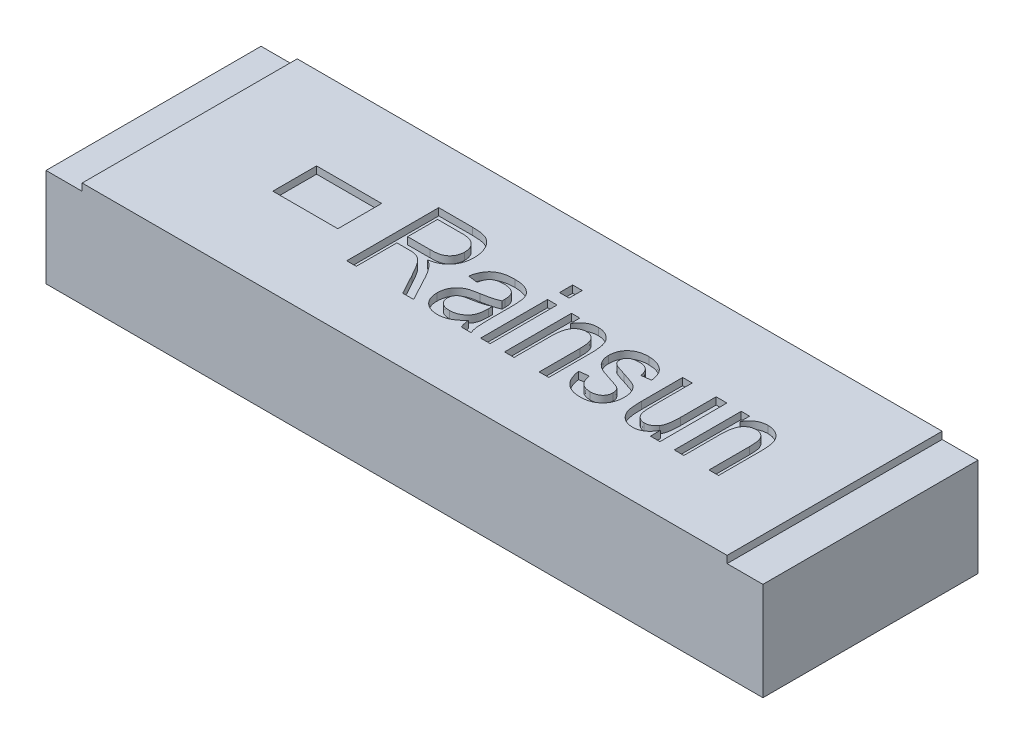
from build123d import *

# Parameters (mm, degrees)
ESQUISSE1_W             = 10
ESQUISSE1_H             = 3
BOSS_EXTRU_1_DEPTH      = 1.47
ESQUISSE2_W             = 0.907288546
ESQUISSE2_H             = 0.61051192
ENL_V_MAT_EXTRU_1_DEPTH = 0.1
ESQUISSE3_W             = 0.504272693
ESQUISSE3_H             = 3
ESQUISSE3_W_2           = 0.500030517
ENL_V_MAT_EXTRU_2_DEPTH = 0.1
ESQUISSE4_W             = 0.133419152
ESQUISSE4_H             = 0.183451335
ESQUISSE4_H_2           = 0.933934067
ENL_V_MAT_EXTRU_3_DEPTH = 0.1


with BuildPart() as part:
    # Esquisse1 → Boss.-Extru.1 (new body)
    with BuildSketch(Plane(origin=(0, 0, 0), x_dir=(1, 0, 0), z_dir=(0, 1, 0))):
        Rectangle(ESQUISSE1_W, ESQUISSE1_H)
    extrude(amount=BOSS_EXTRU_1_DEPTH)

    # Esquisse2 → Enlèv. mat.-Extru.1 (cut)
    with BuildSketch(Plane(origin=(0, 1.47, 0), x_dir=(1, 0, 0), z_dir=(0, 1, 0))):
        with Locations((-2.613912431, 0.036415608)):
            Rectangle(ESQUISSE2_W, ESQUISSE2_H)
    extrude(amount=-ENL_V_MAT_EXTRU_1_DEPTH, mode=Mode.SUBTRACT)

    # Esquisse3 → Enlèv. mat.-Extru.2 (cut)
    with BuildSketch(Plane(origin=(0, 1.47, 0), x_dir=(1, 0, 0), z_dir=(0, 1, 0))):
        with Locations((-4.747863653, 0)):
            Rectangle(ESQUISSE3_W, ESQUISSE3_H)
        with Locations((4.749984742, 0)):
            Rectangle(ESQUISSE3_W_2, ESQUISSE3_H)
    extrude(amount=-ENL_V_MAT_EXTRU_2_DEPTH, mode=Mode.SUBTRACT)

    # Esquisse4 → Enlèv. mat.-Extru.3 (cut)
    # profile 1 of 8: a face of its own
    with BuildSketch(Plane(origin=(0, 1.47, 0), x_dir=(1, 0, 0), z_dir=(0, 1, 0))):
        with BuildLine():
            Line((-1.711203724, -0.594725924), (-1.711203724, 0.689433418))
            Line((-1.711203724, 0.689433418), (-1.239546173, 0.689433418))
            add(Edge.make_bspline(
                [(-1.239546173, 0.689433418), (-1.227643365, 0.689364904), (-1.204604255, 0.689232288), (-1.171228767, 0.687324534), (-1.14019478, 0.684500455), (-1.11154364, 0.68074553), (-1.085442604, 0.675539719), (-1.061788164, 0.669224698), (-1.040387881, 0.662175813), (-1.015264758, 0.650548614), (-0.986602457, 0.632513675), (-0.955690187, 0.605036536), (-0.928613558, 0.571009644), (-0.904519375, 0.53191409), (-0.884732486, 0.488019038), (-0.870716548, 0.440148818), (-0.862255403, 0.388932385), (-0.861198821, 0.353660202), (-0.860656627, 0.335559963)],
                knots=[0, 0, 0, 0, 0.957775898, 1.853873864, 2.6892683, 3.465319774, 4.178195347, 4.829309051, 5.435011313, 5.988660553, 7.053440284, 8.147710094, 9.30058322, 10.540256924, 11.835580405, 13.162637032, 14.543981594, 16, 16, 16, 16], degree=3))
            add(Edge.make_bspline(
                [(-0.860656627, 0.335559963), (-0.860940115, 0.323565398), (-0.861493857, 0.300136264), (-0.864848274, 0.265796806), (-0.870677477, 0.233224026), (-0.879592243, 0.202502208), (-0.889931186, 0.173249583), (-0.903507548, 0.14597893), (-0.919083837, 0.120338051), (-0.937187905, 0.096530749), (-0.95743797, 0.07461011), (-0.980164448, 0.054920702), (-1.004925444, 0.037182941), (-1.031914027, 0.021552574), (-1.060963165, 0.007829531), (-1.092416471, -0.003120876), (-1.125783737, -0.012710434), (-1.148993522, -0.017108947), (-1.16084972, -0.01935583)],
                knots=[0, 0, 0, 0, 1.121977975, 2.191573688, 3.224240956, 4.211948119, 5.180998842, 6.122125515, 7.055751929, 7.983633331, 8.914994346, 9.842128418, 10.791356962, 11.759862547, 12.75578979, 13.791489111, 14.871831714, 16, 16, 16, 16], degree=3))
            add(Edge.make_bspline(
                [(-1.16084972, -0.01935583), (-1.15209864, -0.02419759), (-1.13543998, -0.033414423), (-1.112641995, -0.0482849), (-1.093158501, -0.063252769), (-1.082144301, -0.074145073), (-1.076941581, -0.079290214)],
                knots=[0, 0, 0, 0, 1.158843086, 2.205987482, 3.152571606, 4, 4, 4, 4], degree=3))
            add(Edge.make_bspline(
                [(-1.076941581, -0.079290214), (-1.066535426, -0.091850862), (-1.045606098, -0.117113401), (-1.01691532, -0.157416614), (-0.989433334, -0.199343229), (-0.973294618, -0.228836442), (-0.965150924, -0.243718896)],
                knots=[0, 0, 0, 0, 0.982253192, 1.975551771, 2.978451105, 4, 4, 4, 4], degree=3))
            Line((-0.965150924, -0.243718896), (-0.777269657, -0.594725924))
            Line((-0.777269657, -0.594725924), (-0.928929709, -0.594725924))
            Line((-0.928929709, -0.594725924), (-1.077202165, -0.320070091))
            add(Edge.make_bspline(
                [(-1.077202165, -0.320070091), (-1.084109369, -0.307191841), (-1.0973212, -0.282558822), (-1.116928928, -0.247583567), (-1.135155684, -0.216041069), (-1.151970687, -0.187900565), (-1.167623128, -0.163460596), (-1.1816813, -0.142385321), (-1.194555973, -0.124914746), (-1.209964918, -0.106914778), (-1.227875314, -0.088255969), (-1.249166419, -0.069516677), (-1.270432795, -0.054989597), (-1.292084881, -0.043926756), (-1.315919177, -0.036638884), (-1.342775739, -0.031183817), (-1.373855876, -0.028216674), (-1.395890981, -0.027875941), (-1.407623035, -0.027694527)],
                knots=[0, 0, 0, 0, 1.483643366, 2.83785556, 4.070616892, 5.1822306, 6.165666296, 7.016844219, 7.754091418, 8.367230408, 9.421242841, 10.377779407, 11.241203819, 12.029974219, 12.835959019, 13.762973995, 14.808950166, 16, 16, 16, 16], degree=3))
            Line((-1.407623035, -0.027694527), (-1.577784571, -0.027694527))
            Line((-1.577784571, -0.027694527), (-1.577784571, -0.594725924))
            Line((-1.577784571, -0.594725924), (-1.711203724, -0.594725924))
        make_face()
        with BuildLine():
            Line((-1.577784571, 0.12240202), (-1.264822848, 0.12240202))
            add(Edge.make_bspline(
                [(-1.264822848, 0.12240202), (-1.248745125, 0.122715215), (-1.218613901, 0.123302174), (-1.176460328, 0.127200432), (-1.140481046, 0.134254808), (-1.110003996, 0.144529186), (-1.084015817, 0.158143083), (-1.061389703, 0.175001763), (-1.041543621, 0.195135881), (-1.02466241, 0.21842467), (-1.010704546, 0.244359545), (-1.001284115, 0.272869431), (-0.994889904, 0.303137004), (-0.994351573, 0.324059408), (-0.994075779, 0.33477821)],
                knots=[0, 0, 0, 0, 1.47306528, 2.760668081, 3.873497699, 4.82484281, 5.696997418, 6.550136397, 7.399890849, 8.276969651, 9.17766846, 10.086208714, 11.019541422, 12, 12, 12, 12], degree=3))
            add(Edge.make_bspline(
                [(-0.994075779, 0.33477821), (-0.994316651, 0.342513932), (-0.994786236, 0.357594925), (-0.997256924, 0.379626815), (-1.002078976, 0.400359423), (-1.008441377, 0.41990416), (-1.016995256, 0.438082464), (-1.026984163, 0.455181281), (-1.039564038, 0.470497613), (-1.053253875, 0.484997606), (-1.069096819, 0.497870289), (-1.086789186, 0.50902418), (-1.106327409, 0.51839365), (-1.127523907, 0.526427584), (-1.15080889, 0.531771478), (-1.175636647, 0.53639986), (-1.202315812, 0.538965888), (-1.22069229, 0.539210683), (-1.230165139, 0.539336871)],
                knots=[0, 0, 0, 0, 1.045235731, 2.037714497, 2.988326782, 3.915852726, 4.808207886, 5.697550021, 6.58254782, 7.478674216, 8.387536059, 9.331464042, 10.296946822, 11.310355404, 12.385965615, 13.518246496, 14.720686494, 16, 16, 16, 16], degree=3))
            Line((-1.230165139, 0.539336871), (-1.577784571, 0.539336871))
            Line((-1.577784571, 0.539336871), (-1.577784571, 0.12240202))
        make_face(mode=Mode.SUBTRACT)
    # profile 2 of 8: a face of its own
    with BuildSketch(Plane(origin=(0, 1.47, 0), x_dir=(1, 0, 0), z_dir=(0, 1, 0))):
        with BuildLine():
            add(Edge.make_bspline(
                [(-0.143528682, -0.465997289), (-0.154468235, -0.477471687), (-0.175736193, -0.499779456), (-0.209803201, -0.52937873), (-0.244547246, -0.554585977), (-0.280014058, -0.575345502), (-0.316234056, -0.59134839), (-0.352977132, -0.603013507), (-0.39055834, -0.60999292), (-0.41589769, -0.610932184), (-0.428607887, -0.611403319)],
                knots=[0, 0, 0, 0, 1.153539222, 2.242634972, 3.279759983, 4.274221825, 5.22822196, 6.156113319, 7.075107937, 8, 8, 8, 8], degree=3))
            add(Edge.make_bspline(
                [(-0.428607887, -0.611403319), (-0.438435473, -0.611242319), (-0.457631387, -0.610927843), (-0.485672383, -0.607324828), (-0.512265288, -0.602103426), (-0.537233995, -0.594068295), (-0.560835319, -0.584298364), (-0.582766282, -0.571908921), (-0.603314313, -0.557550595), (-0.621971167, -0.540807281), (-0.638970306, -0.522412955), (-0.653606255, -0.502129956), (-0.666218887, -0.480450041), (-0.676425676, -0.457100624), (-0.684130076, -0.432240214), (-0.689970715, -0.405941272), (-0.69335696, -0.378096028), (-0.693705182, -0.358993122), (-0.693882686, -0.349255531)],
                knots=[0, 0, 0, 0, 1.119001789, 2.185711136, 3.216323131, 4.202252203, 5.169072212, 6.121655869, 7.066185889, 8.01954035, 8.972175414, 9.914421449, 10.863296537, 11.8249363, 12.810865371, 13.824179086, 14.890888434, 16, 16, 16, 16], degree=3))
            add(Edge.make_bspline(
                [(-0.693882686, -0.349255531), (-0.69353742, -0.336281011), (-0.692865361, -0.311026224), (-0.686023539, -0.274374279), (-0.675499907, -0.239930289), (-0.660208961, -0.208004523), (-0.641295358, -0.17897671), (-0.619104601, -0.15296628), (-0.593649907, -0.130471767), (-0.569800907, -0.114444049), (-0.548603723, -0.103328085), (-0.530619846, -0.095609233), (-0.510774281, -0.088351164), (-0.489078038, -0.081486224), (-0.465358883, -0.075657856), (-0.43972935, -0.070149968), (-0.412172133, -0.065230788), (-0.393090151, -0.062470425), (-0.383266222, -0.061049315)],
                knots=[0, 0, 0, 0, 1.315736636, 2.561069718, 3.771447986, 4.962594692, 6.141438714, 7.279577219, 8.422657877, 9.579430637, 10.186831949, 10.850275834, 11.564458882, 12.331400109, 13.159047923, 14.042804356, 14.992381924, 16, 16, 16, 16], degree=3))
            add(Edge.make_bspline(
                [(-0.383266222, -0.061049315), (-0.370047807, -0.058786102), (-0.344503855, -0.054412553), (-0.307787329, -0.046752872), (-0.27368278, -0.039022252), (-0.242451723, -0.030660153), (-0.213693081, -0.022397344), (-0.187816408, -0.013536545), (-0.164443699, -0.004645887), (-0.150258591, 0.002344011), (-0.143528682, 0.005660262)],
                knots=[0, 0, 0, 0, 1.28905306, 2.491033145, 3.605049172, 4.650122195, 5.598672662, 6.480605859, 7.279146522, 8, 8, 8, 8], degree=3))
            Line((-0.143528682, 0.005660262), (-0.143528682, 0.043705567))
            add(Edge.make_bspline(
                [(-0.143528682, 0.043705567), (-0.143584405, 0.050921186), (-0.143691352, 0.06476992), (-0.145728411, 0.084666454), (-0.148127128, 0.102996477), (-0.151939473, 0.119709252), (-0.157304568, 0.134611543), (-0.163181352, 0.14811235), (-0.170397883, 0.159944236), (-0.176349277, 0.166605468), (-0.179228729, 0.169828359)],
                knots=[0, 0, 0, 0, 1.290137808, 2.476124807, 3.574920544, 4.596386969, 5.535069845, 6.404438809, 7.22802268, 8, 8, 8, 8], degree=3))
            add(Edge.make_bspline(
                [(-0.179228729, 0.169828359), (-0.183551845, 0.174035992), (-0.192302424, 0.182552816), (-0.207658117, 0.193201338), (-0.22465146, 0.202290074), (-0.243224952, 0.209889867), (-0.263497691, 0.215667909), (-0.285535044, 0.219330661), (-0.30918883, 0.222149083), (-0.325580832, 0.222358581), (-0.334015793, 0.222466384)],
                knots=[0, 0, 0, 0, 0.860333652, 1.741433159, 2.657216257, 3.608602534, 4.602004448, 5.660502074, 6.796146289, 8, 8, 8, 8], degree=3))
            add(Edge.make_bspline(
                [(-0.334015793, 0.222466384), (-0.348817599, 0.222190906), (-0.376517271, 0.221675383), (-0.415160499, 0.214715578), (-0.448175608, 0.204251782), (-0.471476707, 0.190965374), (-0.48692811, 0.177613735), (-0.497571134, 0.165934532), (-0.507214389, 0.152197565), (-0.516075138, 0.136619755), (-0.524454001, 0.119273907), (-0.531593143, 0.099726099), (-0.538512303, 0.07850157), (-0.541991287, 0.063455109), (-0.54378614, 0.055692444)],
                knots=[0, 0, 0, 0, 1.779102865, 3.329361478, 4.707868851, 5.930643941, 6.523657754, 7.16004944, 7.827207895, 8.539060925, 9.31524689, 10.142348672, 11.041613586, 12, 12, 12, 12], degree=3))
            Line((-0.54378614, 0.055692444), (-0.677205292, 0.072369838))
            add(Edge.make_bspline(
                [(-0.677205292, 0.072369838), (-0.6746457, 0.084300629), (-0.669658139, 0.107548688), (-0.660153398, 0.141011288), (-0.648322067, 0.171891539), (-0.634906828, 0.200270119), (-0.619638087, 0.226082572), (-0.602772377, 0.249516494), (-0.58354256, 0.270061723), (-0.562850968, 0.288609032), (-0.539832226, 0.304665887), (-0.514566988, 0.318447941), (-0.486876042, 0.329827632), (-0.457150904, 0.339627064), (-0.424892047, 0.346662278), (-0.390468463, 0.352269826), (-0.353614155, 0.355303693), (-0.328287911, 0.355687837), (-0.315253724, 0.355885537)],
                knots=[0, 0, 0, 0, 1.146744962, 2.234520216, 3.265547189, 4.251500875, 5.181194384, 6.080940409, 6.959092981, 7.820811418, 8.688273039, 9.590681915, 10.520124471, 11.498613844, 12.528476545, 13.619677679, 14.774963812, 16, 16, 16, 16], degree=3))
            add(Edge.make_bspline(
                [(-0.315253724, 0.355885537), (-0.305086886, 0.35572767), (-0.285339386, 0.355421038), (-0.25655435, 0.35327447), (-0.229467085, 0.350024508), (-0.204018506, 0.345109237), (-0.180337555, 0.338453911), (-0.158077739, 0.331103848), (-0.137620289, 0.321981536), (-0.113455309, 0.307848546), (-0.086878996, 0.288215429), (-0.060184769, 0.261680933), (-0.040645415, 0.231700139), (-0.029900586, 0.204429285), (-0.024183109, 0.180956965), (-0.02023026, 0.161499807), (-0.017214594, 0.139993131), (-0.014621651, 0.116616334), (-0.012584311, 0.091327038), (-0.010957999, 0.064224103), (-0.010267022, 0.035196834), (-0.010163225, 0.015215191), (-0.01010953, 0.004878509)],
                knots=[0, 0, 0, 0, 1.116479382, 2.168587404, 3.16840818, 4.111316371, 5.011567079, 5.868311402, 6.683862369, 7.465978748, 8.938885496, 10.301521261, 11.576846205, 12.839874513, 13.499268829, 14.228894422, 15.019458851, 15.883290383, 16.811756148, 17.805505868, 18.864768531, 20, 20, 20, 20], degree=3))
            Line((-0.01010953, 0.004878509), (-0.01010953, -0.205152423))
            add(Edge.make_bspline(
                [(-0.01010953, -0.205152423), (-0.010165956, -0.222698786), (-0.010273224, -0.256055204), (-0.009554569, -0.303565901), (-0.009212021, -0.345958997), (-0.008262254, -0.38330379), (-0.007758159, -0.415546449), (-0.006280731, -0.442635408), (-0.005145186, -0.464632387), (-0.002217593, -0.496631822), (0.005573161, -0.540065111), (0.017356986, -0.576513161), (0.023245258, -0.594725924)],
                knots=[0, 0, 0, 0, 1.33924071, 2.545956183, 3.626711962, 4.574996917, 5.397345641, 6.087652113, 6.645549812, 7.078325684, 8.540065522, 10, 10, 10, 10], degree=3))
            Line((0.023245258, -0.594725924), (-0.110173894, -0.594725924))
            add(Edge.make_bspline(
                [(-0.110173894, -0.594725924), (-0.114280952, -0.585332088), (-0.12268473, -0.566110612), (-0.1318327, -0.534934559), (-0.139253788, -0.501427608), (-0.14207839, -0.478017306), (-0.143528682, -0.465997289)],
                knots=[0, 0, 0, 0, 0.920202936, 1.882900402, 2.912975517, 4, 4, 4, 4], degree=3))
        make_face()
        with BuildLine():
            add(Edge.make_bspline(
                [(-0.143528682, -0.127758891), (-0.150187708, -0.131035672), (-0.164042118, -0.137853166), (-0.186282848, -0.147228466), (-0.210815776, -0.156083556), (-0.237782936, -0.164241051), (-0.266890145, -0.172723949), (-0.298383379, -0.180425739), (-0.332115008, -0.187720826), (-0.35537379, -0.192172375), (-0.367370581, -0.194468467)],
                knots=[0, 0, 0, 0, 0.759937497, 1.581085096, 2.470290631, 3.429739441, 4.465916236, 5.57487507, 6.749129853, 8, 8, 8, 8], degree=3))
            add(Edge.make_bspline(
                [(-0.367370581, -0.194468467), (-0.380675697, -0.196633762), (-0.405196049, -0.200624242), (-0.438780983, -0.207432557), (-0.465801933, -0.215072315), (-0.487231244, -0.223244753), (-0.504266373, -0.232849033), (-0.51874445, -0.243886836), (-0.531409725, -0.25670757), (-0.541775708, -0.271407136), (-0.5501675, -0.2873274), (-0.556316537, -0.304491568), (-0.559604852, -0.322898562), (-0.560173432, -0.335519627), (-0.560463534, -0.341959171)],
                knots=[0, 0, 0, 0, 1.792080477, 3.302672748, 4.55256871, 5.521793876, 6.343933024, 7.143043091, 7.93511388, 8.729789758, 9.525220353, 10.321404951, 11.1435441, 12, 12, 12, 12], degree=3))
            add(Edge.make_bspline(
                [(-0.560463534, -0.341959171), (-0.560074166, -0.351851101), (-0.559324422, -0.37089845), (-0.550350565, -0.397752119), (-0.536790697, -0.421748249), (-0.517264129, -0.442032344), (-0.493026574, -0.458322285), (-0.464218759, -0.469679221), (-0.43147505, -0.4768459), (-0.408236254, -0.477592282), (-0.396034852, -0.477984166)],
                knots=[0, 0, 0, 0, 0.982989349, 1.89278952, 2.793465746, 3.712871111, 4.674195932, 5.684718148, 6.784373966, 8, 8, 8, 8], degree=3))
            add(Edge.make_bspline(
                [(-0.396034852, -0.477984166), (-0.384101615, -0.477623709), (-0.360571594, -0.476912958), (-0.326178208, -0.470059388), (-0.293309882, -0.459503684), (-0.262653838, -0.444260713), (-0.234600336, -0.425737207), (-0.210067894, -0.403841546), (-0.189236474, -0.379175256), (-0.175139281, -0.356030052), (-0.165820277, -0.335740769), (-0.159823798, -0.318725994), (-0.155085753, -0.300090278), (-0.150372157, -0.280014757), (-0.147554562, -0.258095454), (-0.145083595, -0.234647379), (-0.143883497, -0.209507455), (-0.14364965, -0.192210831), (-0.143528682, -0.183263343)],
                knots=[0, 0, 0, 0, 1.295816986, 2.555099171, 3.797272685, 5.038800039, 6.264426397, 7.441439978, 8.600861566, 9.761973723, 10.374641393, 11.025690135, 11.719692907, 12.46426932, 13.265486335, 14.119543836, 15.027246062, 16, 16, 16, 16], degree=3))
            Line((-0.143528682, -0.183263343), (-0.143528682, -0.127758891))
        make_face(mode=Mode.SUBTRACT)
    # profile 3 of 8: a face of its own
    with BuildSketch(Plane(origin=(0, 1.47, 0), x_dir=(1, 0, 0), z_dir=(0, 1, 0))):
        with Locations((0.223373987, 0.597707751)):
            Rectangle(ESQUISSE4_W, ESQUISSE4_H)
    # profile 4 of 8: a face of its own
    with BuildSketch(Plane(origin=(0, 1.47, 0), x_dir=(1, 0, 0), z_dir=(0, 1, 0))):
        with Locations((0.223373987, -0.12775889)):
            Rectangle(ESQUISSE4_W, ESQUISSE4_H_2)
    # profile 5 of 8: a face of its own
    with BuildSketch(Plane(origin=(0, 1.47, 0), x_dir=(1, 0, 0), z_dir=(0, 1, 0))):
        with BuildLine():
            Line((0.490212292, -0.594725924), (0.490212292, 0.339208143))
            Line((0.490212292, 0.339208143), (0.60695405, 0.339208143))
            Line((0.60695405, 0.339208143), (0.60695405, 0.20578899))
            add(Edge.make_bspline(
                [(0.60695405, 0.20578899), (0.61406544, 0.217781316), (0.627804069, 0.240949519), (0.652324591, 0.271869217), (0.679291506, 0.297829966), (0.708494217, 0.319268411), (0.740056806, 0.335971001), (0.774157878, 0.347305277), (0.81033198, 0.354632098), (0.835276277, 0.355462264), (0.847994511, 0.355885537)],
                knots=[0, 0, 0, 0, 1.116801742, 2.157570631, 3.152411596, 4.109288682, 5.053077691, 6.00219512, 6.981388438, 8, 8, 8, 8], degree=3))
            add(Edge.make_bspline(
                [(0.847994511, 0.355885537), (0.858000172, 0.355575102), (0.877676931, 0.354964611), (0.906616234, 0.350426457), (0.93436821, 0.342933076), (0.960633964, 0.332113105), (0.985089147, 0.319203094), (1.007705654, 0.304700828), (1.027130115, 0.287496748), (1.044770197, 0.268902348), (1.059714379, 0.247571103), (1.07295214, 0.223754378), (1.083360719, 0.196635795), (1.090743361, 0.172135284), (1.095621309, 0.15038025), (1.098523285, 0.131726167), (1.101626791, 0.111005588), (1.103390568, 0.088186348), (1.1054636, 0.063366978), (1.106243448, 0.036410898), (1.107168236, 0.007403695), (1.10723928, -0.01266646), (1.107275872, -0.023004009)],
                knots=[0, 0, 0, 0, 1.141513664, 2.244858084, 3.334220807, 4.4147531, 5.47892906, 6.48793521, 7.471744892, 8.432665683, 9.406385771, 10.43563962, 11.534566808, 12.713805952, 13.353541494, 14.077102385, 14.86776246, 15.743679306, 16.687940983, 17.709721097, 18.820344297, 20, 20, 20, 20], degree=3))
            Line((1.107275872, -0.023004009), (1.107275872, -0.594725924))
            Line((1.107275872, -0.594725924), (0.973856719, -0.594725924))
            Line((0.973856719, -0.594725924), (0.973856719, -0.027173358))
            add(Edge.make_bspline(
                [(0.973856719, -0.027173358), (0.973675123, -0.011187033), (0.973337179, 0.018562963), (0.970477746, 0.059782019), (0.965140145, 0.094045582), (0.957975153, 0.122248153), (0.947981293, 0.145404643), (0.935921993, 0.165356414), (0.92114596, 0.182456995), (0.904136333, 0.19680524), (0.885389344, 0.208396258), (0.864921497, 0.216510278), (0.84312684, 0.221683292), (0.828045991, 0.222202302), (0.820372577, 0.222466384)],
                knots=[0, 0, 0, 0, 1.730600132, 3.220586765, 4.468134926, 5.480892051, 6.361235774, 7.188558294, 7.99531897, 8.795973777, 9.589417829, 10.369941221, 11.170596028, 12, 12, 12, 12], degree=3))
            add(Edge.make_bspline(
                [(0.820372577, 0.222466384), (0.81306168, 0.222297187), (0.798704677, 0.221964919), (0.77782421, 0.218441178), (0.758061117, 0.212979039), (0.739451827, 0.2053407), (0.721811432, 0.195754251), (0.705627063, 0.183516559), (0.690337403, 0.169437494), (0.676540272, 0.152816288), (0.663698117, 0.13378884), (0.652923451, 0.111558402), (0.643861325, 0.086277692), (0.636300552, 0.058050316), (0.630733886, 0.026649788), (0.62664417, -0.007803262), (0.623961677, -0.045372151), (0.623744339, -0.071467797), (0.623631444, -0.085023069)],
                knots=[0, 0, 0, 0, 0.848519953, 1.666307634, 2.452162119, 3.226006161, 3.998269853, 4.777227891, 5.576824152, 6.40751938, 7.280639208, 8.237274995, 9.268282867, 10.396604152, 11.627583492, 12.969211337, 14.425669814, 16, 16, 16, 16], degree=3))
            Line((0.623631444, -0.085023069), (0.623631444, -0.594725924))
            Line((0.623631444, -0.594725924), (0.490212292, -0.594725924))
        make_face()
    # profile 6 of 8: a face of its own
    with BuildSketch(Plane(origin=(0, 1.47, 0), x_dir=(1, 0, 0), z_dir=(0, 1, 0))):
        with BuildLine():
            Line((1.240695024, -0.311210226), (1.374114177, -0.294532831))
            add(Edge.make_bspline(
                [(1.374114177, -0.294532831), (1.376371874, -0.309134141), (1.380651409, -0.336811375), (1.393510596, -0.375020136), (1.4111472, -0.407433118), (1.434135307, -0.433748593), (1.461810733, -0.453874476), (1.493697685, -0.468017437), (1.529597183, -0.476475508), (1.554824742, -0.477466862), (1.567988883, -0.477984166)],
                knots=[0, 0, 0, 0, 1.189281864, 2.254320617, 3.232274242, 4.145201865, 5.047107826, 5.968481238, 6.939921219, 8, 8, 8, 8], degree=3))
            add(Edge.make_bspline(
                [(1.567988883, -0.477984166), (1.581060894, -0.477529106), (1.605799619, -0.476667907), (1.640667575, -0.469049624), (1.671027041, -0.45643928), (1.696100725, -0.438060837), (1.716022648, -0.416069067), (1.730901074, -0.391108173), (1.739430877, -0.362910053), (1.740477777, -0.343231953), (1.741016846, -0.333099305)],
                knots=[0, 0, 0, 0, 1.234162119, 2.335646571, 3.354322508, 4.318233937, 5.248195862, 6.142280526, 7.043423072, 8, 8, 8, 8], degree=3))
            add(Edge.make_bspline(
                [(1.741016846, -0.333099305), (1.740730591, -0.3244613), (1.740185505, -0.308012878), (1.734350077, -0.284893321), (1.724714975, -0.264653264), (1.715222993, -0.25378473), (1.710528485, -0.248409414)],
                knots=[0, 0, 0, 0, 1.120009958, 2.132714175, 3.076485076, 4, 4, 4, 4], degree=3))
            add(Edge.make_bspline(
                [(1.710528485, -0.248409414), (1.708398624, -0.246614348), (1.703462041, -0.242453752), (1.694034373, -0.237026578), (1.682233513, -0.230979389), (1.667778946, -0.224725985), (1.650630704, -0.218430453), (1.631002064, -0.211215522), (1.608704056, -0.204076166), (1.592925107, -0.199308934), (1.584666277, -0.196813726)],
                knots=[0, 0, 0, 0, 0.488033344, 1.131161561, 1.901529161, 2.816272222, 3.89210763, 5.107205245, 6.485887592, 8, 8, 8, 8], degree=3))
            add(Edge.make_bspline(
                [(1.584666277, -0.196813726), (1.572494937, -0.193113045), (1.549153579, -0.186016135), (1.51573333, -0.175257325), (1.485254398, -0.165225235), (1.457786253, -0.15533877), (1.433397318, -0.14558622), (1.411633004, -0.13686609), (1.392877032, -0.128372393), (1.372219859, -0.117380577), (1.349636257, -0.102609062), (1.325789537, -0.082297564), (1.305299052, -0.059064943), (1.28794248, -0.033486723), (1.274466668, -0.005425159), (1.264331164, 0.02453576), (1.258675252, 0.056523248), (1.257811584, 0.078429379), (1.257372418, 0.0895684)],
                knots=[0, 0, 0, 0, 1.285567247, 2.465372316, 3.547942052, 4.528124874, 5.414867895, 6.202193361, 6.897424025, 7.494322112, 8.565551231, 9.617619906, 10.649836794, 11.686968674, 12.731245229, 13.786056767, 14.87423479, 16, 16, 16, 16], degree=3))
            add(Edge.make_bspline(
                [(1.257372418, 0.0895684), (1.25762462, 0.099222998), (1.258117258, 0.118081811), (1.261924386, 0.145721744), (1.267756096, 0.172052274), (1.276360754, 0.197003582), (1.287787188, 0.220246385), (1.301054574, 0.242411449), (1.317110833, 0.263087949), (1.335579256, 0.28224721), (1.356017487, 0.299780788), (1.378791967, 0.314705534), (1.403300405, 0.327507729), (1.429778006, 0.337924265), (1.458055237, 0.346025622), (1.488168241, 0.351584139), (1.520113359, 0.355486835), (1.542091529, 0.355750116), (1.553396163, 0.355885537)],
                knots=[0, 0, 0, 0, 1.030981229, 2.013867803, 2.975009643, 3.908154563, 4.825293019, 5.737112229, 6.663218639, 7.614772901, 8.57591474, 9.533242064, 10.516829137, 11.524797792, 12.56736321, 13.653765094, 14.793196781, 16, 16, 16, 16], degree=3))
            add(Edge.make_bspline(
                [(1.553396163, 0.355885537), (1.567572042, 0.355456131), (1.595174807, 0.354620006), (1.635255716, 0.348980493), (1.672664669, 0.338977927), (1.707160819, 0.325222521), (1.738571855, 0.308388492), (1.766169372, 0.288474704), (1.789892839, 0.265894237), (1.810093203, 0.240243003), (1.826497805, 0.210084138), (1.839837745, 0.174810872), (1.850826348, 0.133964744), (1.855363342, 0.10456732), (1.857758605, 0.089047232)],
                knots=[0, 0, 0, 0, 1.129175769, 2.198690688, 3.215779298, 4.206399659, 5.150677169, 6.047525639, 6.908839248, 7.7517529, 8.637509676, 9.632036873, 10.749856573, 12, 12, 12, 12], degree=3))
            Line((1.857758605, 0.089047232), (1.724339452, 0.072369838))
            add(Edge.make_bspline(
                [(1.724339452, 0.072369838), (1.722511116, 0.084166611), (1.719036173, 0.106587605), (1.708692541, 0.137725946), (1.693617451, 0.163881577), (1.674808587, 0.185835368), (1.651269243, 0.202417993), (1.623778464, 0.214249545), (1.592225854, 0.221308817), (1.569851167, 0.222067482), (1.55808668, 0.222466384)],
                knots=[0, 0, 0, 0, 1.1431212, 2.172620705, 3.123755036, 4.020570385, 4.921665579, 5.857517289, 6.873494463, 8, 8, 8, 8], degree=3))
            add(Edge.make_bspline(
                [(1.55808668, 0.222466384), (1.544855316, 0.222109658), (1.520062183, 0.22144122), (1.485492883, 0.21547045), (1.45596182, 0.205929103), (1.432025884, 0.191694931), (1.413671131, 0.174236275), (1.400449117, 0.154404963), (1.39215467, 0.132146386), (1.391253063, 0.116393604), (1.390791571, 0.108330469)],
                knots=[0, 0, 0, 0, 1.395580077, 2.6150593, 3.690777698, 4.653104214, 5.528564533, 6.342314364, 7.151505917, 8, 8, 8, 8], degree=3))
            add(Edge.make_bspline(
                [(1.390791571, 0.108330469), (1.391233399, 0.100516795), (1.392098487, 0.085217817), (1.400677608, 0.063903118), (1.414143598, 0.044986946), (1.426539061, 0.035582825), (1.433006225, 0.030676353)],
                knots=[0, 0, 0, 0, 1.01333812, 1.98409065, 2.948226741, 4, 4, 4, 4], degree=3))
            add(Edge.make_bspline(
                [(1.433006225, 0.030676353), (1.435592856, 0.029163756), (1.441669059, 0.025610546), (1.452666292, 0.020523124), (1.466763221, 0.01481743), (1.483974127, 0.008730909), (1.504118944, 0.001500928), (1.527513614, -0.005800705), (1.553914184, -0.014348852), (1.572664151, -0.019839335), (1.582581603, -0.022743425)],
                knots=[0, 0, 0, 0, 0.451775428, 1.061256619, 1.825217529, 2.745334864, 3.814398542, 5.053265661, 6.441378765, 8, 8, 8, 8], degree=3))
            add(Edge.make_bspline(
                [(1.582581603, -0.022743425), (1.59545219, -0.02660342), (1.619952683, -0.03395132), (1.654691187, -0.045196727), (1.685721186, -0.055843933), (1.713038378, -0.065918965), (1.736624715, -0.07551157), (1.756363854, -0.084704532), (1.772762486, -0.0927136), (1.789070359, -0.103624667), (1.806067244, -0.11799386), (1.823760243, -0.137484501), (1.838920359, -0.159888737), (1.85171178, -0.185004607), (1.861743666, -0.212776816), (1.869521846, -0.242915597), (1.873441675, -0.275755056), (1.874096935, -0.298433146), (1.874435999, -0.310167888)],
                knots=[0, 0, 0, 0, 1.4208324, 2.704701155, 3.860775016, 4.889580377, 5.783364499, 6.551894129, 7.192743352, 7.709885825, 8.62249147, 9.539385676, 10.484551591, 11.474534214, 12.511954784, 13.601300886, 14.758796889, 16, 16, 16, 16], degree=3))
            add(Edge.make_bspline(
                [(1.874435999, -0.310167888), (1.874188009, -0.32112239), (1.873702189, -0.342582673), (1.869825881, -0.374031695), (1.862889329, -0.403787286), (1.854001694, -0.432143255), (1.84171752, -0.458653309), (1.827242771, -0.483744009), (1.809821545, -0.507070684), (1.79007044, -0.528707842), (1.767962654, -0.548179301), (1.743934993, -0.565283584), (1.7177664, -0.579379221), (1.689793167, -0.591196577), (1.659726299, -0.600247499), (1.627801287, -0.606713444), (1.593975042, -0.610710998), (1.570779802, -0.61116842), (1.558868433, -0.611403319)],
                knots=[0, 0, 0, 0, 1.067785082, 2.091831323, 3.081950917, 4.043300278, 4.98307574, 5.924185488, 6.862433727, 7.815392752, 8.775286569, 9.729148088, 10.68406144, 11.666985355, 12.684886385, 13.739427528, 14.839136272, 16, 16, 16, 16], degree=3))
            add(Edge.make_bspline(
                [(1.558868433, -0.611403319), (1.547743444, -0.611115603), (1.526049404, -0.610554548), (1.494282831, -0.607272661), (1.464427854, -0.601198188), (1.4361523, -0.59322752), (1.409944315, -0.582481301), (1.385293333, -0.56966577), (1.362716858, -0.554181421), (1.341549426, -0.536678096), (1.322644485, -0.516452574), (1.305182036, -0.494153103), (1.289968821, -0.46930557), (1.276251005, -0.442250125), (1.264660869, -0.412800551), (1.254790907, -0.380986819), (1.246322065, -0.347004488), (1.242598617, -0.323319201), (1.240695024, -0.311210226)],
                knots=[0, 0, 0, 0, 1.0975712, 2.140294732, 3.145156112, 4.099659636, 5.033637147, 5.934321845, 6.835006543, 7.729105615, 8.638227824, 9.560299488, 10.518487775, 11.507108274, 12.549268399, 13.63594966, 14.791392054, 16, 16, 16, 16], degree=3))
        make_face()
    # profile 7 of 8: a face of its own
    with BuildSketch(Plane(origin=(0, 1.47, 0), x_dir=(1, 0, 0), z_dir=(0, 1, 0))):
        with BuildLine():
            Line((2.524854367, -0.594725924), (2.524854367, -0.456095086))
            add(Edge.make_bspline(
                [(2.524854367, -0.456095086), (2.517642174, -0.468421608), (2.503731098, -0.492197342), (2.479337041, -0.524051447), (2.452837048, -0.550860217), (2.424591157, -0.573091453), (2.394236179, -0.590213317), (2.362070978, -0.602655857), (2.327850707, -0.610165346), (2.304350728, -0.610986293), (2.292413187, -0.611403319)],
                knots=[0, 0, 0, 0, 1.162811047, 2.242861849, 3.258749658, 4.227055075, 5.161937843, 6.087208066, 7.028338228, 8, 8, 8, 8], degree=3))
            add(Edge.make_bspline(
                [(2.292413187, -0.611403319), (2.278464426, -0.610812357), (2.25120969, -0.609657665), (2.211959883, -0.600350534), (2.175858279, -0.584978729), (2.143282456, -0.563934248), (2.115320489, -0.537746864), (2.091741502, -0.508364838), (2.073487344, -0.475598204), (2.060643193, -0.438867031), (2.051662216, -0.397363441), (2.045785716, -0.349742608), (2.041816289, -0.295468043), (2.041419677, -0.257016931), (2.041209939, -0.236683121)],
                knots=[0, 0, 0, 0, 0.975841366, 1.906714037, 2.805934724, 3.711835674, 4.607016011, 5.477071768, 6.340127012, 7.219317907, 8.191684727, 9.308178129, 10.576504205, 12, 12, 12, 12], degree=3))
            Line((2.041209939, -0.236683121), (2.041209939, 0.339208143))
            Line((2.041209939, 0.339208143), (2.174629092, 0.339208143))
            Line((2.174629092, 0.339208143), (2.174629092, -0.177791073))
            add(Edge.make_bspline(
                [(2.174629092, -0.177791073), (2.174699597, -0.189256923), (2.174834738, -0.21123427), (2.175287379, -0.24277029), (2.176268467, -0.271358983), (2.177901882, -0.296891193), (2.179593099, -0.319504678), (2.181986038, -0.339128873), (2.184391751, -0.355880305), (2.188565951, -0.373859133), (2.195159684, -0.393526005), (2.206767504, -0.414214069), (2.220188727, -0.433167619), (2.236973696, -0.448940539), (2.255743011, -0.461717217), (2.275901806, -0.471284417), (2.297490772, -0.476975751), (2.312271061, -0.477644609), (2.319774537, -0.477984166)],
                knots=[0, 0, 0, 0, 1.461737108, 2.801807361, 4.02069174, 5.107921661, 6.063387644, 6.910850146, 7.628149795, 8.219102699, 9.262712775, 10.258707732, 11.23323409, 12.212279723, 13.176687428, 14.117930526, 15.044534017, 16, 16, 16, 16], degree=3))
            add(Edge.make_bspline(
                [(2.319774537, -0.477984166), (2.326821271, -0.477694638), (2.340648647, -0.477126515), (2.36093446, -0.47380918), (2.380148634, -0.467651505), (2.398461184, -0.459306655), (2.415886894, -0.448547831), (2.431936428, -0.435077483), (2.44736923, -0.419574485), (2.456367336, -0.407740459), (2.461011218, -0.401632971)],
                knots=[0, 0, 0, 0, 1.011738666, 1.985272825, 2.939456909, 3.899001163, 4.867653817, 5.868503706, 6.899944278, 8, 8, 8, 8], degree=3))
            add(Edge.make_bspline(
                [(2.461011218, -0.401632971), (2.464813815, -0.39563773), (2.472849433, -0.382968636), (2.482305784, -0.361084836), (2.490258948, -0.335902619), (2.497021191, -0.307431089), (2.502140644, -0.27546604), (2.505680969, -0.240139132), (2.507709015, -0.201354271), (2.508016425, -0.174405944), (2.508176973, -0.160331926)],
                knots=[0, 0, 0, 0, 0.683097632, 1.44351622, 2.287677003, 3.225364732, 4.259872604, 5.403917773, 6.644171513, 8, 8, 8, 8], degree=3))
            Line((2.508176973, -0.160331926), (2.508176973, 0.339208143))
            Line((2.508176973, 0.339208143), (2.658273519, 0.339208143))
            Line((2.658273519, 0.339208143), (2.658273519, -0.594725924))
            Line((2.658273519, -0.594725924), (2.524854367, -0.594725924))
        make_face()
    # profile 8 of 8: a face of its own
    with BuildSketch(Plane(origin=(0, 1.47, 0), x_dir=(1, 0, 0), z_dir=(0, 1, 0))):
        with BuildLine():
            Line((2.858402248, -0.594725924), (2.858402248, 0.339208143))
            Line((2.858402248, 0.339208143), (2.975144006, 0.339208143))
            Line((2.975144006, 0.339208143), (2.975144006, 0.20578899))
            add(Edge.make_bspline(
                [(2.975144006, 0.20578899), (2.982255396, 0.217781316), (2.995994025, 0.240949519), (3.020514548, 0.271869217), (3.047481463, 0.297829966), (3.076684173, 0.319268411), (3.108246762, 0.335971001), (3.142347835, 0.347305277), (3.178521936, 0.354632098), (3.203466234, 0.355462264), (3.216184467, 0.355885537)],
                knots=[0, 0, 0, 0, 1.116801742, 2.157570631, 3.152411596, 4.109288682, 5.053077691, 6.00219512, 6.981388438, 8, 8, 8, 8], degree=3))
            add(Edge.make_bspline(
                [(3.216184467, 0.355885537), (3.226190128, 0.355575102), (3.245866887, 0.354964611), (3.274806191, 0.350426457), (3.302558167, 0.342933076), (3.32882392, 0.332113105), (3.353279104, 0.319203094), (3.37589561, 0.304700828), (3.395320071, 0.287496748), (3.412960153, 0.268902348), (3.427904335, 0.247571103), (3.441142096, 0.223754378), (3.451550675, 0.196635795), (3.458933317, 0.172135284), (3.463811265, 0.15038025), (3.466713241, 0.131726167), (3.469816748, 0.111005588), (3.471580524, 0.088186348), (3.473653557, 0.063366978), (3.474433405, 0.036410898), (3.475358192, 0.007403695), (3.475429236, -0.01266646), (3.475465828, -0.023004009)],
                knots=[0, 0, 0, 0, 1.141513664, 2.244858084, 3.334220807, 4.4147531, 5.47892906, 6.48793521, 7.471744892, 8.432665683, 9.406385771, 10.43563962, 11.534566808, 12.713805952, 13.353541494, 14.077102385, 14.86776246, 15.743679306, 16.687940983, 17.709721097, 18.820344297, 20, 20, 20, 20], degree=3))
            Line((3.475465828, -0.023004009), (3.475465828, -0.594725924))
            Line((3.475465828, -0.594725924), (3.342046676, -0.594725924))
            Line((3.342046676, -0.594725924), (3.342046676, -0.027173358))
            add(Edge.make_bspline(
                [(3.342046676, -0.027173358), (3.34186508, -0.011187033), (3.341527135, 0.018562963), (3.338667702, 0.059782019), (3.333330101, 0.094045582), (3.326165109, 0.122248153), (3.316171249, 0.145404643), (3.304111949, 0.165356414), (3.289335916, 0.182456995), (3.27232629, 0.19680524), (3.2535793, 0.208396258), (3.233111453, 0.216510278), (3.211316797, 0.221683292), (3.196235948, 0.222202302), (3.188562533, 0.222466384)],
                knots=[0, 0, 0, 0, 1.730600132, 3.220586765, 4.468134926, 5.480892051, 6.361235774, 7.188558294, 7.99531897, 8.795973777, 9.589417829, 10.369941221, 11.170596028, 12, 12, 12, 12], degree=3))
            add(Edge.make_bspline(
                [(3.188562533, 0.222466384), (3.181251636, 0.222297187), (3.166894633, 0.221964919), (3.146014166, 0.218441178), (3.126251073, 0.212979039), (3.107641783, 0.2053407), (3.090001388, 0.195754251), (3.073817019, 0.183516559), (3.058527359, 0.169437494), (3.044730228, 0.152816288), (3.031888073, 0.13378884), (3.021113407, 0.111558402), (3.012051281, 0.086277692), (3.004490508, 0.058050316), (2.998923843, 0.026649788), (2.994834126, -0.007803262), (2.992151633, -0.045372151), (2.991934296, -0.071467797), (2.9918214, -0.085023069)],
                knots=[0, 0, 0, 0, 0.848519953, 1.666307634, 2.452162119, 3.226006161, 3.998269853, 4.777227891, 5.576824152, 6.40751938, 7.280639208, 8.237274995, 9.268282867, 10.396604152, 11.627583492, 12.969211337, 14.425669814, 16, 16, 16, 16], degree=3))
            Line((2.9918214, -0.085023069), (2.9918214, -0.594725924))
            Line((2.9918214, -0.594725924), (2.858402248, -0.594725924))
        make_face()
    extrude(amount=-ENL_V_MAT_EXTRU_3_DEPTH, mode=Mode.SUBTRACT)


solid = part.part
